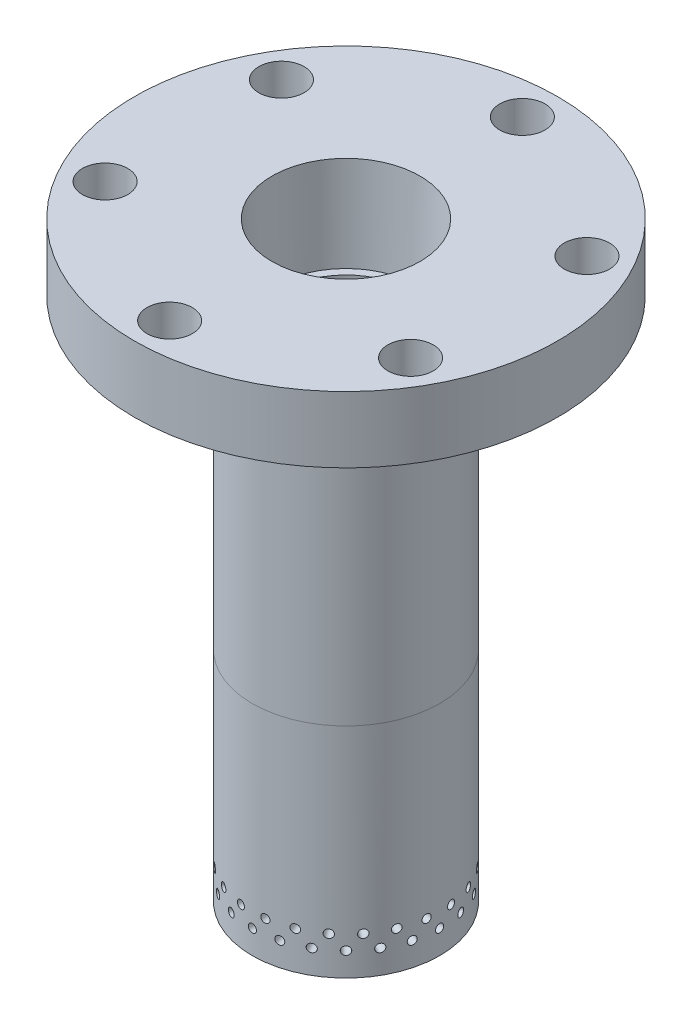
from build123d import *

# Parameters (mm, degrees)
F_1_4_CLEARANCE_HOLE1_D     = 6.5278
F_1_4_CLEARANCE_HOLE1_DEPTH = 22.606
F_1_4_CLEARANCE_HOLE1_TIP   = 1.961148974
CHAMFER1_SIZE               = 1
F_135_DEG_SIZE              = 5.08
F_135_DEG_SIZE2             = 12.264204897
SKETCH6_R                   = 0.59055
CUT_EXTRUDE_56_DEPTH        = 101.012005859
CIRPATTERN1_COUNT           = 24
SKETCH7_R                   = 0.59055
CUT_EXTRUDE_56_2_DEPTH      = 101.012005859
CIRPATTERN2_COUNT           = 24


with BuildPart() as part:
    # Sketch1 → Revolve1 (revolve)
    with BuildSketch(Plane.XY):
        Polygon((0, 0), (-30.48, 0), (-30.48, -9.525), (-21, -9.525), (-21, -7.775), (-18, -7.775), (-18, -9.525), (-13.5, -9.525), (-13.5, -90.246), (0, -90.246), align=None)
    revolve(axis=Axis((0, 0, 0), (0, 1, 0)))

    # Sketch3 → 1/2 NPT Tapped Hole1 (revolve, cut)
    with BuildSketch(Plane(origin=(0, 0, 0), x_dir=(0, 0, 1), z_dir=(1, 0, 0))):
        Polygon((0, 0), (0, 86.330993174), (9.128125, 82.55), (9.128125, 13.462), (10.261665792, 13.462), (10.6647361, 0), align=None)
    revolve(axis=Axis((0, 6.35, 0), (0, -1, 0)), mode=Mode.SUBTRACT)

    # 1/4 Clearance Hole1
    with Locations(Plane(origin=(0, 0, 0), x_dir=(1, 0, 0), z_dir=(0, 1, 0))):
        with Locations((21.997045256, 12.7), (0, 25.4), (-21.997045256, 12.7), (-21.997045256, -12.7), (0, -25.4), (21.997045256, -12.7)):
            Hole(F_1_4_CLEARANCE_HOLE1_D / 2, depth=F_1_4_CLEARANCE_HOLE1_DEPTH)
            with Locations((0, 0, -(F_1_4_CLEARANCE_HOLE1_DEPTH + F_1_4_CLEARANCE_HOLE1_TIP / 2))):  # 118° drill point
                Cone(0, F_1_4_CLEARANCE_HOLE1_D / 2, F_1_4_CLEARANCE_HOLE1_TIP, mode=Mode.SUBTRACT)

    # Chamfer1
    chamfer1_edges = [part.edges().sort_by_distance(p)[0] for p in [
        (13.5, -9.525, 0),
    ]]
    chamfer(chamfer1_edges, length=CHAMFER1_SIZE)

    # 135-deg
    f_135_deg_edges = [part.edges().sort_by_distance(p)[0] for p in [
        (13.5, -90.246, 0),
    ]]
    f_135_deg_side = [part.faces().sort_by_distance(p)[0] for p in [
        (13.5, -50.3855, 0),
    ]]
    chamfer(f_135_deg_edges, length=F_135_DEG_SIZE, length2=F_135_DEG_SIZE2, reference=f_135_deg_side[0])

    # Sketch6 → #56 (cut, through all)
    with BuildSketch(Plane.XY):
        with Locations((0, -81.737)):
            Circle(SKETCH6_R)
    cut_extrude_56 = extrude(amount=-CUT_EXTRUDE_56_DEPTH, mode=Mode.SUBTRACT)

    # CirPattern1: #56 ×24 about axis
    cirpattern1_axis = Axis((0, 0, 0), (0, -1, 0))
    for i in range(1, CIRPATTERN1_COUNT):
        add(cut_extrude_56.rotate(cirpattern1_axis, i * 360 / CIRPATTERN1_COUNT), mode=Mode.SUBTRACT)

    # Sketch7 → #56-2 (cut, through all)
    with BuildSketch(Plane(origin=(0, 0, 0), x_dir=(0, -1, 0), z_dir=(0.9914448613738104, 0, 0.13052619222005188))):
        with Locations((79.705, 0)):
            Circle(SKETCH7_R)
    cut_extrude_56_2 = extrude(amount=-CUT_EXTRUDE_56_2_DEPTH, mode=Mode.SUBTRACT)

    # CirPattern2: #56-2 ×24 about axis
    cirpattern2_axis = Axis((0, 0, 0), (0, -1, 0))
    for i in range(1, CIRPATTERN2_COUNT):
        add(cut_extrude_56_2.rotate(cirpattern2_axis, i * 360 / CIRPATTERN2_COUNT), mode=Mode.SUBTRACT)


solid = part.part
